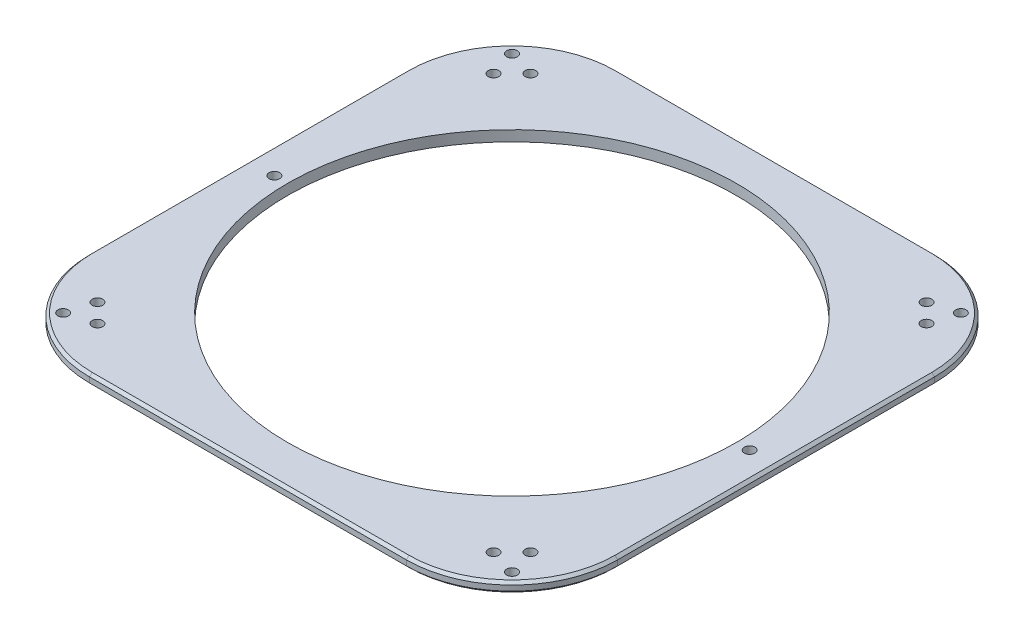
from build123d import *

# Parameters (mm, degrees)
SKETCH_1_W      = 200
SKETCH_1_H      = 200
SKETCH_1_R      = 2
SKETCH_1_R_2    = 85
EXTRUDE_1_DEPTH = 4
FILLET_1_R      = 40
CHAMFER_1_SIZE  = 1


with BuildPart() as part:
    # Эскиз1 → Бобышка-Вытянуть1 (new body)
    with BuildSketch(Plane(origin=(0, 0, 0), x_dir=(1, 0, 0), z_dir=(0, 1, 0))):
        Rectangle(SKETCH_1_W, SKETCH_1_H)
        with Locations((-85, 85)):
            Circle(SKETCH_1_R, mode=Mode.SUBTRACT)
        with Locations((85, 85)):
            Circle(SKETCH_1_R, mode=Mode.SUBTRACT)
        with Locations((85, -85)):
            Circle(SKETCH_1_R, mode=Mode.SUBTRACT)
        with Locations((-85, -85)):
            Circle(SKETCH_1_R, mode=Mode.SUBTRACT)
        with Locations((-90, 0)):
            Circle(SKETCH_1_R, mode=Mode.SUBTRACT)
        with Locations((90, 0)):
            Circle(SKETCH_1_R, mode=Mode.SUBTRACT)
        with Locations((75, 82)):
            Circle(SKETCH_1_R, mode=Mode.SUBTRACT)
        with Locations((-75, 82)):
            Circle(SKETCH_1_R, mode=Mode.SUBTRACT)
        with Locations((75, -82)):
            Circle(SKETCH_1_R, mode=Mode.SUBTRACT)
        with Locations((-75, -82)):
            Circle(SKETCH_1_R, mode=Mode.SUBTRACT)
        with Locations((82, -75)):
            Circle(SKETCH_1_R, mode=Mode.SUBTRACT)
        with Locations((-82, -75)):
            Circle(SKETCH_1_R, mode=Mode.SUBTRACT)
        with Locations((-82, 75)):
            Circle(SKETCH_1_R, mode=Mode.SUBTRACT)
        with Locations((81.987312617, 75.001883036)):
            Circle(SKETCH_1_R, mode=Mode.SUBTRACT)
        Circle(SKETCH_1_R_2, mode=Mode.SUBTRACT)
    extrude(amount=EXTRUDE_1_DEPTH)

    # Скругление1
    fillet_1_edges = [part.edges().sort_by_distance(p)[0] for p in [
        (-100, 2, -100),
        (-100, 2, 100),
        (100, 2, -100),
        (100, 2, 100),
    ]]
    fillet(fillet_1_edges, radius=FILLET_1_R)

    # Фаска1
    chamfer_1_edges = [part.edges().sort_by_distance(p)[0] for p in [
        (-100, 0, 0),
        (-88.284271247, 0, 88.284271247),
        (-88.284271247, 0, -88.284271247),
        (0, 0, 100),
        (0, 0, -100),
        (88.284271247, 0, 88.284271247),
        (88.284271247, 0, -88.284271247),
        (100, 0, 0),
        (-100, 4, 0),
        (-88.284271247, 4, 88.284271247),
        (-88.284271247, 4, -88.284271247),
        (0, 4, 100),
        (0, 4, -100),
        (88.284271247, 4, 88.284271247),
        (88.284271247, 4, -88.284271247),
        (100, 4, 0),
    ]]
    chamfer(chamfer_1_edges, length=CHAMFER_1_SIZE)


solid = part.part
